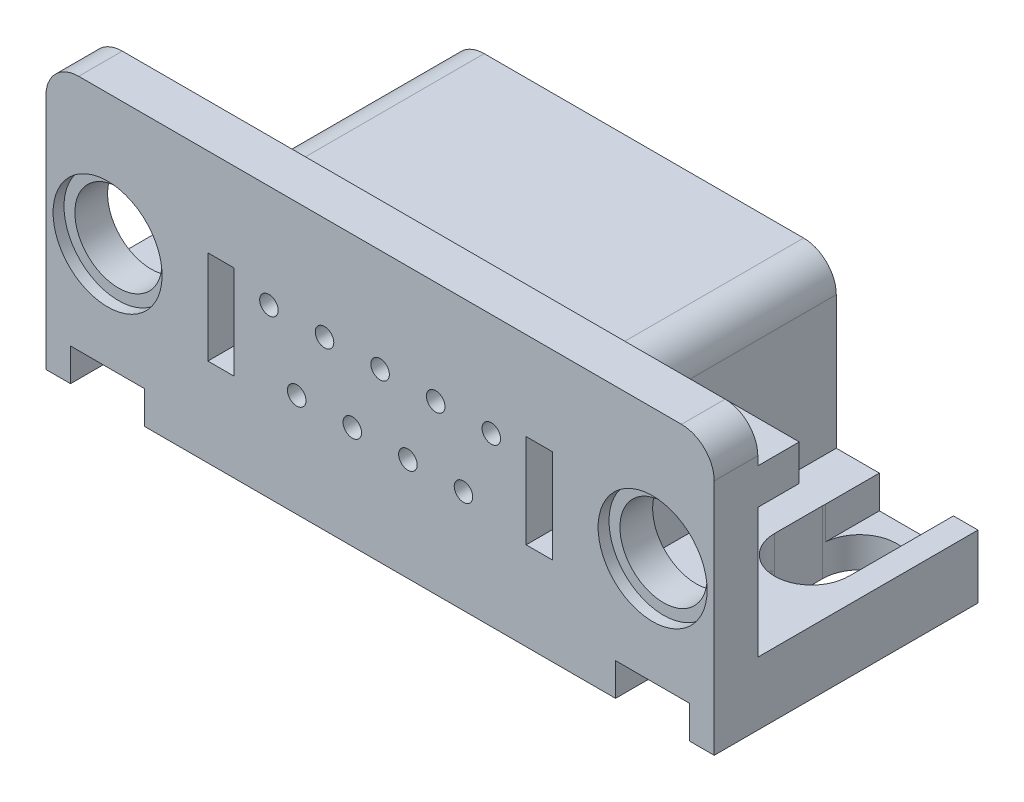
from build123d import *

# Parameters (mm, degrees)
SKETCH1_W           = 30.65
SKETCH1_H           = 12.1
BOSS_EXTRUDE1_DEPTH = 12.4
SKETCH2_R           = 2
SKETCH2_W           = 1.2
SKETCH2_H           = 4.3
CUT_EXTRUDE1_DEPTH  = 10
SKETCH3_R           = 0.425
CUT_EXTRUDE2_DEPTH  = 12.4
SKETCH4_W           = 30.65
SKETCH4_H           = 1.9
SKETCH4_W_2         = 17.6
SKETCH4_H_2         = 0.8
SKETCH4_W_3         = 6.5
SKETCH4_H_3         = 5.95
CUT_EXTRUDE3_DEPTH  = 10.1
CUT_EXTRUDE4_REACH  = 21.537
SKETCH6_W           = 6.5
SKETCH6_H           = 8.2
SKETCH7_W           = 15.65
SKETCH7_H           = 6.6
CUT_EXTRUDE5_DEPTH  = 6.35
CUT_EXTRUDE6_REACH  = 21.019
FILLET1_R           = 1.5
SKETCH10_W          = 3.4
SKETCH10_H          = 3
CUT_EXTRUDE7_DEPTH  = 4.8
SKETCH11_W          = 3.4
SKETCH11_H          = 3
CUT_EXTRUDE8_DEPTH  = 9.5
FILLET2_R           = 1.5
SKETCH12_R          = 2.5
CUT_EXTRUDE9_DEPTH  = 0.5
CUT_EXTRUDE10_REACH = 22.15
SKETCH13_W          = 0.8
SKETCH13_H          = 1.6
SKETCH13_H_2        = 4.5
FILLET3_R           = 0.25
SKETCH14_R          = 0.725
CUT_EXTRUDE11_DEPTH = 1


with BuildPart() as part:
    # Sketch1 → Boss-Extrude1 (new body)
    with BuildSketch(Plane(origin=(0, 0, 0), x_dir=(1, 0, 0), z_dir=(0, 1, 0))):
        Rectangle(SKETCH1_W, SKETCH1_H)
    extrude(amount=BOSS_EXTRUDE1_DEPTH)

    # Sketch2 → Cut-Extrude1 (cut)
    with BuildSketch(Plane.XY.offset(6.05)):
        with Locations((-12.5, 6.4)):
            Circle(SKETCH2_R)
        with Locations(Location((12.5, 6.4, 0), (0, 0, 180))):
            Circle(SKETCH2_R)
        with Locations((-7.3, 6.2)):
            Rectangle(SKETCH2_W, SKETCH2_H)
        with Locations((7.3, 6.2)):
            Rectangle(SKETCH2_W, SKETCH2_H)
    extrude(amount=-CUT_EXTRUDE1_DEPTH, mode=Mode.SUBTRACT)

    # Sketch3 → Cut-Extrude2 (cut)
    with BuildSketch(Plane.XY.offset(6.05)):
        with Locations((-5.1, 7.675)):
            Circle(SKETCH3_R)
        with Locations((-2.55, 7.675)):
            Circle(SKETCH3_R)
        with Locations((0, 7.675)):
            Circle(SKETCH3_R)
        with Locations((2.55, 7.675)):
            Circle(SKETCH3_R)
        with Locations((5.1, 7.675)):
            Circle(SKETCH3_R)
        with Locations((-3.825, 4.725)):
            Circle(SKETCH3_R)
        with Locations((-1.275, 4.725)):
            Circle(SKETCH3_R)
        with Locations((1.275, 4.725)):
            Circle(SKETCH3_R)
        with Locations((3.825, 4.725)):
            Circle(SKETCH3_R)
    extrude(amount=-CUT_EXTRUDE2_DEPTH, mode=Mode.SUBTRACT)

    # Sketch4 → Cut-Extrude3 (cut)
    with BuildSketch(Plane(origin=(0, 0, -6.05), x_dir=(-1, 0, 0), z_dir=(0, 0, -1))):
        with Locations((0, 11.45)):
            Rectangle(SKETCH4_W, SKETCH4_H)
        with Locations((0, 0.4)):
            Rectangle(SKETCH4_W_2, SKETCH4_H_2)
        with Locations((12.075, 5.875)):
            Rectangle(SKETCH4_W_3, SKETCH4_H_3)
        with Locations((-12.075, 5.875)):
            Rectangle(SKETCH4_W_3, SKETCH4_H_3)
    extrude(amount=-CUT_EXTRUDE3_DEPTH, mode=Mode.SUBTRACT)

    # Sketch6 → Cut-Extrude4 (cut, up to next)
    with BuildSketch(Plane(origin=(0, 10.5, 0), x_dir=(1, 0, 0), z_dir=(0, 1, 0)), mode=Mode.PRIVATE) as cut_extrude4_sk1:
        with Locations((12.075, 1.95)):
            Rectangle(SKETCH6_W, SKETCH6_H)
    cut_extrude4_tool1 = extrude(cut_extrude4_sk1.sketch, amount=-CUT_EXTRUDE4_REACH, mode=Mode.PRIVATE) & part.part
    # Sketch6 → Cut-Extrude4 (cut, up to next)
    with BuildSketch(Plane(origin=(0, 10.5, 0), x_dir=(1, 0, 0), z_dir=(0, 1, 0)), mode=Mode.PRIVATE) as cut_extrude4_sk2:
        with Locations((-12.075, 1.95)):
            Rectangle(SKETCH6_W, SKETCH6_H)
    cut_extrude4_tool2 = extrude(cut_extrude4_sk2.sketch, amount=-CUT_EXTRUDE4_REACH, mode=Mode.PRIVATE) & part.part
    add(cut_extrude4_tool1.solids().sort_by_distance((12.075, 10.5, -1.95))[0], mode=Mode.SUBTRACT)
    add(cut_extrude4_tool2.solids().sort_by_distance((-12.075, 10.5, -1.95))[0], mode=Mode.SUBTRACT)

    # Sketch7 → Cut-Extrude5 (cut)
    with BuildSketch(Plane(origin=(0, 0, -6.05), x_dir=(-1, 0, 0), z_dir=(0, 0, -1))):
        with Locations((0, 6.2)):
            Rectangle(SKETCH7_W, SKETCH7_H)
    extrude(amount=-CUT_EXTRUDE5_DEPTH, mode=Mode.SUBTRACT)

    # Sketch8 → Cut-Extrude6 (cut, up to next)
    with BuildSketch(Plane(origin=(0, 2.9, 0), x_dir=(1, 0, 0), z_dir=(0, 1, 0)), mode=Mode.PRIVATE) as cut_extrude6_sk1:
        with BuildLine():
            Line((-10.795, 3.45), (-10.795, 1.25))
            ThreePointArc((-10.795, 1.25), (-12.495, -0.45), (-14.195, 1.25))
            Line((-14.195, 1.25), (-14.195, 3.45))
            ThreePointArc((-14.195, 3.45), (-12.495, 5.15), (-10.795, 3.45))
        make_face()
    cut_extrude6_tool1 = extrude(cut_extrude6_sk1.sketch, amount=-CUT_EXTRUDE6_REACH, mode=Mode.PRIVATE) & part.part
    # Sketch8 → Cut-Extrude6 (cut, up to next)
    with BuildSketch(Plane(origin=(0, 2.9, 0), x_dir=(1, 0, 0), z_dir=(0, 1, 0)), mode=Mode.PRIVATE) as cut_extrude6_sk2:
        with BuildLine():
            Line((10.795, 3.45), (10.795, 1.25))
            ThreePointArc((10.795, 1.25), (12.495, -0.45), (14.195, 1.25))
            Line((14.195, 1.25), (14.195, 3.45))
            ThreePointArc((14.195, 3.45), (12.495, 5.15), (10.795, 3.45))
        make_face()
    cut_extrude6_tool2 = extrude(cut_extrude6_sk2.sketch, amount=-CUT_EXTRUDE6_REACH, mode=Mode.PRIVATE) & part.part
    add(cut_extrude6_tool1.solids().sort_by_distance((-12.495, 2.9, -2.35))[0], mode=Mode.SUBTRACT)
    add(cut_extrude6_tool2.solids().sort_by_distance((12.495, 2.9, -2.35))[0], mode=Mode.SUBTRACT)

    # Fillet1
    fillet1_edges = [part.edges().sort_by_distance(p)[0] for p in [
        (8.825, 10.5, -1.95),
        (-8.825, 10.5, -1.95),
    ]]
    fillet(fillet1_edges, radius=FILLET1_R)

    # Sketch10 → Cut-Extrude7 (cut)
    with BuildSketch(Plane(origin=(0, 0, -6.05), x_dir=(-1, 0, 0), z_dir=(0, 0, -1))):
        with Locations((-12.5, 2.9)):
            Rectangle(SKETCH10_W, SKETCH10_H)
    cut_extrude7 = extrude(amount=-CUT_EXTRUDE7_DEPTH, mode=Mode.SUBTRACT)

    # Sketch11 → Cut-Extrude8 (cut)
    with BuildSketch(Plane.XY.offset(6.05)):
        with Locations((12.5, 0)):
            Rectangle(SKETCH11_W, SKETCH11_H)
    cut_extrude8 = extrude(amount=-CUT_EXTRUDE8_DEPTH, mode=Mode.SUBTRACT)

    # Mirror3: Cut-Extrude7, Cut-Extrude8 across plane
    add(cut_extrude7.mirror(Plane(origin=(0, 0, 0), x_dir=(0, 0, 1), z_dir=(1, 0, 0))), mode=Mode.SUBTRACT)
    add(cut_extrude8.mirror(Plane(origin=(0, 0, 0), x_dir=(0, 0, 1), z_dir=(1, 0, 0))), mode=Mode.SUBTRACT)

    # Fillet2
    fillet2_edges = [part.edges().sort_by_distance(p)[0] for p in [
        (15.325, 12.4, 5.05),
        (-15.325, 12.4, 5.05),
    ]]
    fillet(fillet2_edges, radius=FILLET2_R)

    # Sketch12 → Cut-Extrude9 (cut)
    with BuildSketch(Plane.XY.offset(6.05)):
        with Locations((-12.5, 6.4)):
            Circle(SKETCH12_R)
        with Locations((12.5, 6.4)):
            Circle(SKETCH12_R)
    extrude(amount=-CUT_EXTRUDE9_DEPTH, mode=Mode.SUBTRACT)

    # Sketch13 → Cut-Extrude10 (cut, up to next)
    with BuildSketch(Plane.XZ.offset(-0.8), mode=Mode.PRIVATE) as cut_extrude10_sk1:
        with Locations((5.095, -5.25)):
            Rectangle(SKETCH13_W, SKETCH13_H)
    cut_extrude10_tool1 = extrude(cut_extrude10_sk1.sketch, amount=-CUT_EXTRUDE10_REACH, mode=Mode.PRIVATE) & part.part
    # Sketch13 → Cut-Extrude10 (cut, up to next)
    with BuildSketch(Plane.XZ.offset(-0.8), mode=Mode.PRIVATE) as cut_extrude10_sk2:
        with Locations((1.275, -3.8)):
            Rectangle(SKETCH13_W, SKETCH13_H_2)
    cut_extrude10_tool2 = extrude(cut_extrude10_sk2.sketch, amount=-CUT_EXTRUDE10_REACH, mode=Mode.PRIVATE) & part.part
    # Sketch13 → Cut-Extrude10 (cut, up to next)
    with BuildSketch(Plane.XZ.offset(-0.8), mode=Mode.PRIVATE) as cut_extrude10_sk3:
        with Locations((3.825, -3.8)):
            Rectangle(SKETCH13_W, SKETCH13_H_2)
    cut_extrude10_tool3 = extrude(cut_extrude10_sk3.sketch, amount=-CUT_EXTRUDE10_REACH, mode=Mode.PRIVATE) & part.part
    # Sketch13 → Cut-Extrude10 (cut, up to next)
    with BuildSketch(Plane.XZ.offset(-0.8), mode=Mode.PRIVATE) as cut_extrude10_sk4:
        with Locations((2.545, -5.25)):
            Rectangle(SKETCH13_W, SKETCH13_H)
    cut_extrude10_tool4 = extrude(cut_extrude10_sk4.sketch, amount=-CUT_EXTRUDE10_REACH, mode=Mode.PRIVATE) & part.part
    # Sketch13 → Cut-Extrude10 (cut, up to next)
    with BuildSketch(Plane.XZ.offset(-0.8), mode=Mode.PRIVATE) as cut_extrude10_sk5:
        with Locations((-1.275, -3.8)):
            Rectangle(SKETCH13_W, SKETCH13_H_2)
    cut_extrude10_tool5 = extrude(cut_extrude10_sk5.sketch, amount=-CUT_EXTRUDE10_REACH, mode=Mode.PRIVATE) & part.part
    # Sketch13 → Cut-Extrude10 (cut, up to next)
    with BuildSketch(Plane.XZ.offset(-0.8), mode=Mode.PRIVATE) as cut_extrude10_sk6:
        with Locations((-0.005, -5.25)):
            Rectangle(SKETCH13_W, SKETCH13_H)
    cut_extrude10_tool6 = extrude(cut_extrude10_sk6.sketch, amount=-CUT_EXTRUDE10_REACH, mode=Mode.PRIVATE) & part.part
    # Sketch13 → Cut-Extrude10 (cut, up to next)
    with BuildSketch(Plane.XZ.offset(-0.8), mode=Mode.PRIVATE) as cut_extrude10_sk7:
        with Locations((-3.825, -3.8)):
            Rectangle(SKETCH13_W, SKETCH13_H_2)
    cut_extrude10_tool7 = extrude(cut_extrude10_sk7.sketch, amount=-CUT_EXTRUDE10_REACH, mode=Mode.PRIVATE) & part.part
    # Sketch13 → Cut-Extrude10 (cut, up to next)
    with BuildSketch(Plane.XZ.offset(-0.8), mode=Mode.PRIVATE) as cut_extrude10_sk8:
        with Locations((-2.555, -5.25)):
            Rectangle(SKETCH13_W, SKETCH13_H)
    cut_extrude10_tool8 = extrude(cut_extrude10_sk8.sketch, amount=-CUT_EXTRUDE10_REACH, mode=Mode.PRIVATE) & part.part
    # Sketch13 → Cut-Extrude10 (cut, up to next)
    with BuildSketch(Plane.XZ.offset(-0.8), mode=Mode.PRIVATE) as cut_extrude10_sk9:
        with Locations((-5.095, -5.25)):
            Rectangle(SKETCH13_W, SKETCH13_H)
    cut_extrude10_tool9 = extrude(cut_extrude10_sk9.sketch, amount=-CUT_EXTRUDE10_REACH, mode=Mode.PRIVATE) & part.part
    add(cut_extrude10_tool1.solids().sort_by_distance((5.095, 0.8, -5.25))[0], mode=Mode.SUBTRACT)
    add(cut_extrude10_tool2.solids().sort_by_distance((1.275, 0.8, -3.8))[0], mode=Mode.SUBTRACT)
    add(cut_extrude10_tool3.solids().sort_by_distance((3.825, 0.8, -3.8))[0], mode=Mode.SUBTRACT)
    add(cut_extrude10_tool4.solids().sort_by_distance((2.545, 0.8, -5.25))[0], mode=Mode.SUBTRACT)
    add(cut_extrude10_tool5.solids().sort_by_distance((-1.275, 0.8, -3.8))[0], mode=Mode.SUBTRACT)
    add(cut_extrude10_tool6.solids().sort_by_distance((-0.005, 0.8, -5.25))[0], mode=Mode.SUBTRACT)
    add(cut_extrude10_tool7.solids().sort_by_distance((-3.825, 0.8, -3.8))[0], mode=Mode.SUBTRACT)
    add(cut_extrude10_tool8.solids().sort_by_distance((-2.555, 0.8, -5.25))[0], mode=Mode.SUBTRACT)
    add(cut_extrude10_tool9.solids().sort_by_distance((-5.095, 0.8, -5.25))[0], mode=Mode.SUBTRACT)

    # Fillet3
    # the kernel refuses this fillet: 0.25 mm, written as the material it takes off along each edge
    with BuildSketch(Plane(origin=(5.495, 0.175, -6.05), x_dir=(1, 0, 0), z_dir=(0, 1, 0))) as fillet3_piece_1:
        with BuildLine():
            CenterArc((FILLET3_R, -FILLET3_R), FILLET3_R, 90, 90)
            Line((0, -FILLET3_R), (0, 0))
            Line((0, 0), (FILLET3_R, 0))
        make_face()
    extrude(amount=3.35, mode=Mode.SUBTRACT)
    with BuildSketch(Plane(origin=(4.695, 0.175, -6.05), x_dir=(-1, 0, 0), z_dir=(0, 1, 0)), Plane(origin=(-4.225, 0.175, -6.05), x_dir=(-1, 0, 0), z_dir=(0, 1, 0)), Plane(origin=(-3.425, 0.175, -6.05), x_dir=(0, 0, 1), z_dir=(0, 1, 0)), Plane(origin=(-2.955, 0.175, -6.05), x_dir=(-1, 0, 0), z_dir=(0, 1, 0)), Plane(origin=(-2.155, 0.175, -6.05), x_dir=(0, 0, 1), z_dir=(0, 1, 0)), Plane(origin=(-1.675, 0.175, -6.05), x_dir=(-1, 0, 0), z_dir=(0, 1, 0)), Plane(origin=(-0.875, 0.175, -6.05), x_dir=(0, 0, 1), z_dir=(0, 1, 0)), Plane(origin=(-0.405, 0.175, -6.05), x_dir=(-1, 0, 0), z_dir=(0, 1, 0)), Plane(origin=(0.395, 0.175, -6.05), x_dir=(0, 0, 1), z_dir=(0, 1, 0)), Plane(origin=(0.875, 0.175, -6.05), x_dir=(-1, 0, 0), z_dir=(0, 1, 0)), Plane(origin=(1.675, 0.175, -6.05), x_dir=(0, 0, 1), z_dir=(0, 1, 0)), Plane(origin=(-5.495, 0.175, -6.05), x_dir=(-1, 0, 0), z_dir=(0, 1, 0)), Plane(origin=(-4.695, 0.175, -6.05), x_dir=(0, 0, 1), z_dir=(0, 1, 0)), Plane(origin=(3.425, 0.175, -6.05), x_dir=(-1, 0, 0), z_dir=(0, 1, 0)), Plane(origin=(4.225, 0.175, -6.05), x_dir=(0, 0, 1), z_dir=(0, 1, 0)), Plane(origin=(2.145, 0.175, -6.05), x_dir=(-1, 0, 0), z_dir=(0, 1, 0)), Plane(origin=(2.945, 0.175, -6.05), x_dir=(0, 0, 1), z_dir=(0, 1, 0))) as fillet3_piece_2:
        with BuildLine():
            CenterArc((FILLET3_R, FILLET3_R), FILLET3_R, 180, 90)
            Line((0, FILLET3_R), (0, 0))
            Line((0, 0), (FILLET3_R, 0))
        make_face()
    extrude(amount=3.35, mode=Mode.SUBTRACT)

    # Sketch14 → Cut-Extrude11 (cut)
    with BuildSketch(Plane(origin=(0, 0, 0.3), x_dir=(-1, 0, 0), z_dir=(0, 0, -1))):
        with Locations((-2.55, 7.675)):
            Circle(SKETCH14_R)
        with Locations((-5.1, 7.675)):
            Circle(SKETCH14_R)
        with Locations((0, 7.675)):
            Circle(SKETCH14_R)
        with Locations((2.55, 7.675)):
            Circle(SKETCH14_R)
        with Locations((5.1, 7.675)):
            Circle(SKETCH14_R)
        with Locations((3.825, 4.725)):
            Circle(SKETCH14_R)
        with Locations((1.275, 4.725)):
            Circle(SKETCH14_R)
        with Locations((-1.275, 4.725)):
            Circle(SKETCH14_R)
        with Locations((-3.825, 4.725)):
            Circle(SKETCH14_R)
    extrude(amount=-CUT_EXTRUDE11_DEPTH, mode=Mode.SUBTRACT)


solid = part.part
